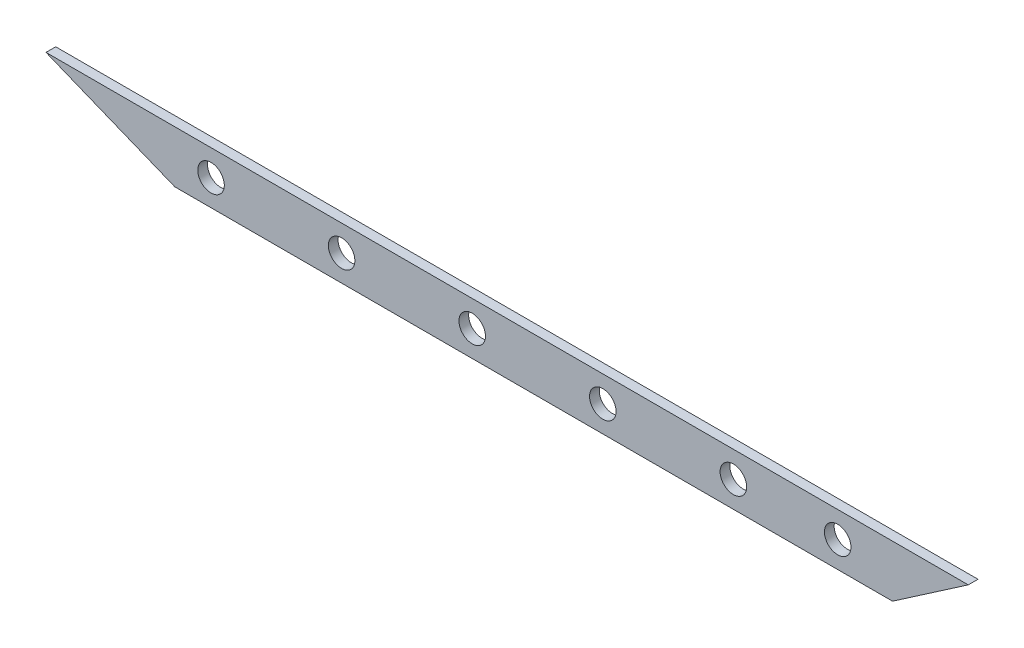
from build123d import *

# Parameters (mm, degrees)
BOSS_EXTRUDE1_DEPTH = 4.7625
SKETCH1_4_R         = 6.5
CUT_EXTRUDE1_DEPTH  = 439.920211962
CUT_EXTRUDE3_DEPTH  = 10
CUT_EXTRUDE4_REACH  = 440.92


with BuildPart() as part:
    # Sketch1 → Boss-Extrude1 (new body)
    with BuildSketch(Plane.XY):
        Polygon((428.120588235, 28.570833333), (0, 28.570833333), (-98.879411765, 3.850980392), (-31.879411765, -96.649019608), (366, -96.649019608), (403.120588235, -71.149019608), align=None)
    extrude(amount=BOSS_EXTRUDE1_DEPTH)

    # Sketch1<4> → Cut-Extrude1 (cut, through all)
    with BuildSketch(Plane.XY):
        with Locations((32, -83.899019608)):
            Circle(SKETCH1_4_R)
        with Locations((96, -83.899019608)):
            Circle(SKETCH1_4_R)
        with Locations((160, -83.899019608)):
            Circle(SKETCH1_4_R)
        with Locations((224, -83.899019608)):
            Circle(SKETCH1_4_R)
        with Locations((288, -83.899019608)):
            Circle(SKETCH1_4_R)
        with Locations((339.120588235, -83.899019608)):
            Circle(SKETCH1_4_R)
    extrude(amount=CUT_EXTRUDE1_DEPTH, mode=Mode.SUBTRACT)

    # Sketch6 → Cut-Extrude3 (cut)
    with BuildSketch(Plane.XY.offset(4.7625)):
        Polygon((-48.879411765, -71.149019608), (14.235302997, -96.649019608), (-31.879411765, -96.649019608), align=None)
    extrude(amount=-CUT_EXTRUDE3_DEPTH, mode=Mode.SUBTRACT)

    # Sketch7 → Cut-Extrude4 (cut, up to next)
    with BuildSketch(Plane.XY.offset(4.7625), mode=Mode.PRIVATE) as cut_extrude4_sk1:
        Polygon((-48.879411765, -71.149019608), (403.120588235, -71.149019608), (428.120588235, 28.570833333), (0, 28.570833333), (-98.879411765, 3.850980392), align=None)
    cut_extrude4_tool1 = extrude(cut_extrude4_sk1.sketch, amount=-CUT_EXTRUDE4_REACH, mode=Mode.PRIVATE) & part.part
    add(cut_extrude4_tool1.solids().sort_by_distance((173.467548, -20.947586, 4.7625))[0], mode=Mode.SUBTRACT)


solid = part.part
